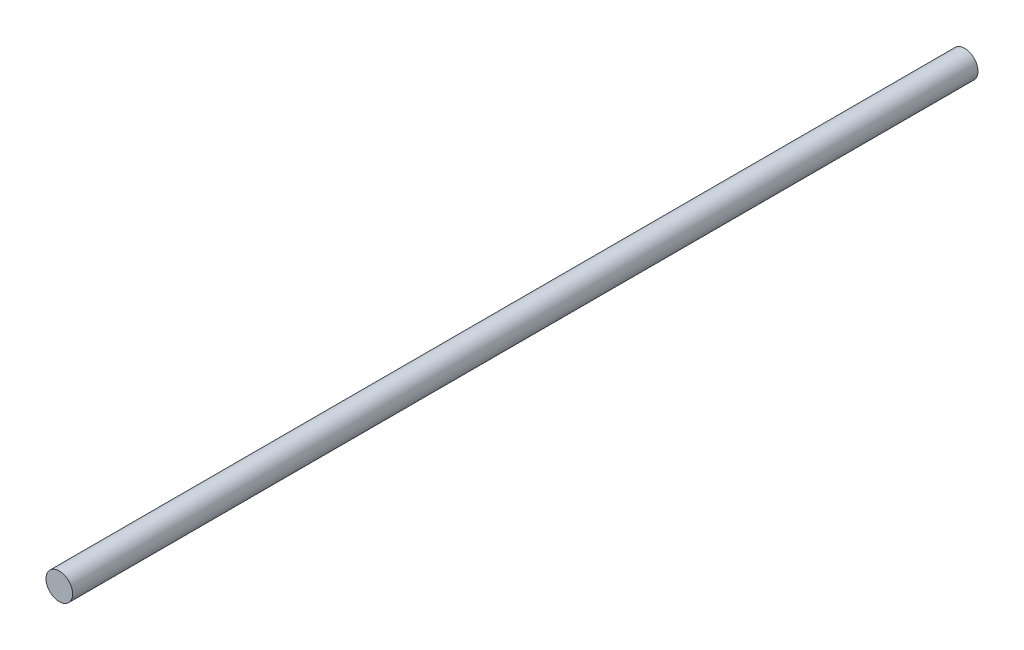
from build123d import *

# Parameters (mm, degrees)
SKETCH1_R           = 5
BOSS_EXTRUDE1_DEPTH = 340


with BuildPart() as part:
    # Sketch1 → Boss-Extrude1 (new body)
    with BuildSketch(Plane.XY):
        Circle(SKETCH1_R)
    extrude(amount=BOSS_EXTRUDE1_DEPTH)


solid = part.part
